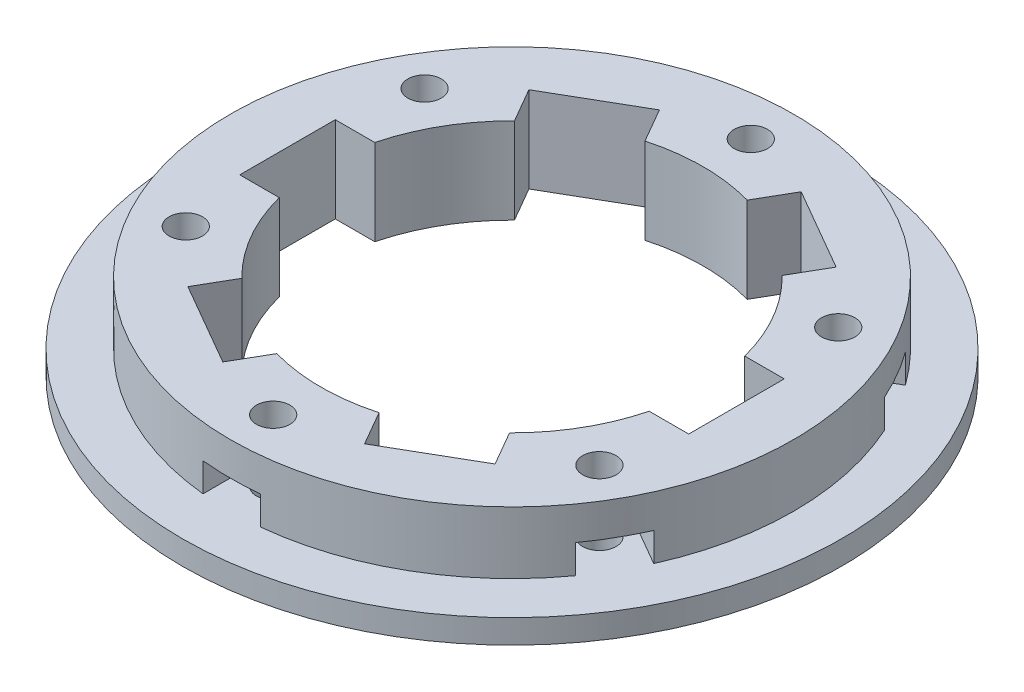
from build123d import *

# Parameters (mm, degrees)
SKETCH1_R           = 34.5
SKETCH1_R_2         = 20
BOSS_EXTRUDE1_DEPTH = 2.5
SKETCH2_R           = 29.5
SKETCH2_R_2         = 20
BOSS_EXTRUDE2_DEPTH = 6.5
SKETCH4_R           = 1.75
CUT_EXTRUDE2_DEPTH  = 50.613506226
CUT_EXTRUDE1_DEPTH  = 50.613506226
CUT_EXTRUDE3_DEPTH  = 3


with BuildPart() as part:
    # Sketch1 → Boss-Extrude1 (new body)
    with BuildSketch(Plane(origin=(0, 0, 0), x_dir=(1, 0, 0), z_dir=(0, 1, 0))):
        Circle(SKETCH1_R)
        Circle(SKETCH1_R_2, mode=Mode.SUBTRACT)
    extrude(amount=BOSS_EXTRUDE1_DEPTH)

    # Sketch2 → Boss-Extrude2 (add)
    with BuildSketch(Plane(origin=(0, 2.5, 0), x_dir=(1, 0, 0), z_dir=(0, 1, 0))):
        Circle(SKETCH2_R)
        Circle(SKETCH2_R_2, mode=Mode.SUBTRACT)
    extrude(amount=BOSS_EXTRUDE2_DEPTH)

    # Sketch4 → Cut-Extrude2 (cut, through all)
    with BuildSketch(Plane(origin=(0, 9, 0), x_dir=(1, 0, 0), z_dir=(0, 1, 0))):
        with Locations((-21.650635095, -12.5)):
            Circle(SKETCH4_R)
        with Locations((-21.650635095, 12.5)):
            Circle(SKETCH4_R)
        with Locations((0, 25)):
            Circle(SKETCH4_R)
        with Locations((21.650635095, 12.5)):
            Circle(SKETCH4_R)
        with Locations((21.650635095, -12.5)):
            Circle(SKETCH4_R)
        with Locations((0, -25)):
            Circle(SKETCH4_R)
    extrude(amount=-CUT_EXTRUDE2_DEPTH, mode=Mode.SUBTRACT)

    # Sketch3 → Cut-Extrude1 (cut, through all)
    with BuildSketch(Plane(origin=(0, 9, 0), x_dir=(1, 0, 0), z_dir=(0, 1, 0))):
        with BuildLine():
            Line((-19.364916731, 5), (-23.5, 5))
            Line((-23.5, 5), (-23.5, -5))
            Line((-23.5, -5), (-19.364916731, -5))
            ThreePointArc((-19.364916731, -5), (-20, 0), (-19.364916731, 5))
        make_face()
        with BuildLine():
            Line((-5.352331347, 19.270509831), (-7.419872981, 22.851596989))
            Line((-7.419872981, 22.851596989), (-16.080127019, 17.851596989))
            Line((-16.080127019, 17.851596989), (-14.012585384, 14.270509831))
            ThreePointArc((-14.012585384, 14.270509831), (-10, 17.320508076), (-5.352331347, 19.270509831))
        make_face()
        with BuildLine():
            Line((14.012585384, 14.270509831), (16.080127019, 17.851596989))
            Line((16.080127019, 17.851596989), (7.419872981, 22.851596989))
            Line((7.419872981, 22.851596989), (5.352331347, 19.270509831))
            ThreePointArc((5.352331347, 19.270509831), (10, 17.320508076), (14.012585384, 14.270509831))
        make_face()
        with BuildLine():
            Line((19.364916731, -5), (23.5, -5))
            Line((23.5, -5), (23.5, 5))
            Line((23.5, 5), (19.364916731, 5))
            ThreePointArc((19.364916731, 5), (20, 0), (19.364916731, -5))
        make_face()
        with BuildLine():
            Line((5.352331347, -19.270509831), (7.419872981, -22.851596989))
            Line((7.419872981, -22.851596989), (16.080127019, -17.851596989))
            Line((16.080127019, -17.851596989), (14.012585384, -14.270509831))
            ThreePointArc((14.012585384, -14.270509831), (10, -17.320508076), (5.352331347, -19.270509831))
        make_face()
        with BuildLine():
            Line((-14.012585384, -14.270509831), (-16.080127019, -17.851596989))
            Line((-16.080127019, -17.851596989), (-7.419872981, -22.851596989))
            Line((-7.419872981, -22.851596989), (-5.352331347, -19.270509831))
            ThreePointArc((-5.352331347, -19.270509831), (-10, -17.320508076), (-14.012585384, -14.270509831))
        make_face()
    extrude(amount=-CUT_EXTRUDE1_DEPTH, mode=Mode.SUBTRACT)

    # Sketch5 → Cut-Extrude3 (cut)
    with BuildSketch(Plane(origin=(0, 2.5, 0), x_dir=(1, 0, 0), z_dir=(0, 1, 0))):
        Polygon((-3, 29.5), (3, 29.5), (3, 23.267949192), (0, 21.535898385), (-3, 23.267949192), align=None)
        Polygon((18.650635095, 14.232050808), (24.047749412, 17.348076211), (27.047749412, 12.151923789), (21.650635095, 9.035898385), (18.650635095, 10.767949192), align=None)
        Polygon((21.650635095, -9.035898385), (27.047749412, -12.151923789), (24.047749412, -17.348076211), (18.650635095, -14.232050808), (18.650635095, -10.767949192), align=None)
        Polygon((3, -23.267949192), (3, -29.5), (-3, -29.5), (-3, -23.267949192), (0, -21.535898385), align=None)
        Polygon((-18.650635095, -14.232050808), (-24.047749412, -17.348076211), (-27.047749412, -12.151923789), (-21.650635095, -9.035898385), (-18.650635095, -10.767949192), align=None)
        Polygon((-21.650635095, 9.035898385), (-27.047749412, 12.151923789), (-24.047749412, 17.348076211), (-18.650635095, 14.232050808), (-18.650635095, 10.767949192), align=None)
    extrude(amount=CUT_EXTRUDE3_DEPTH, mode=Mode.SUBTRACT)


solid = part.part
